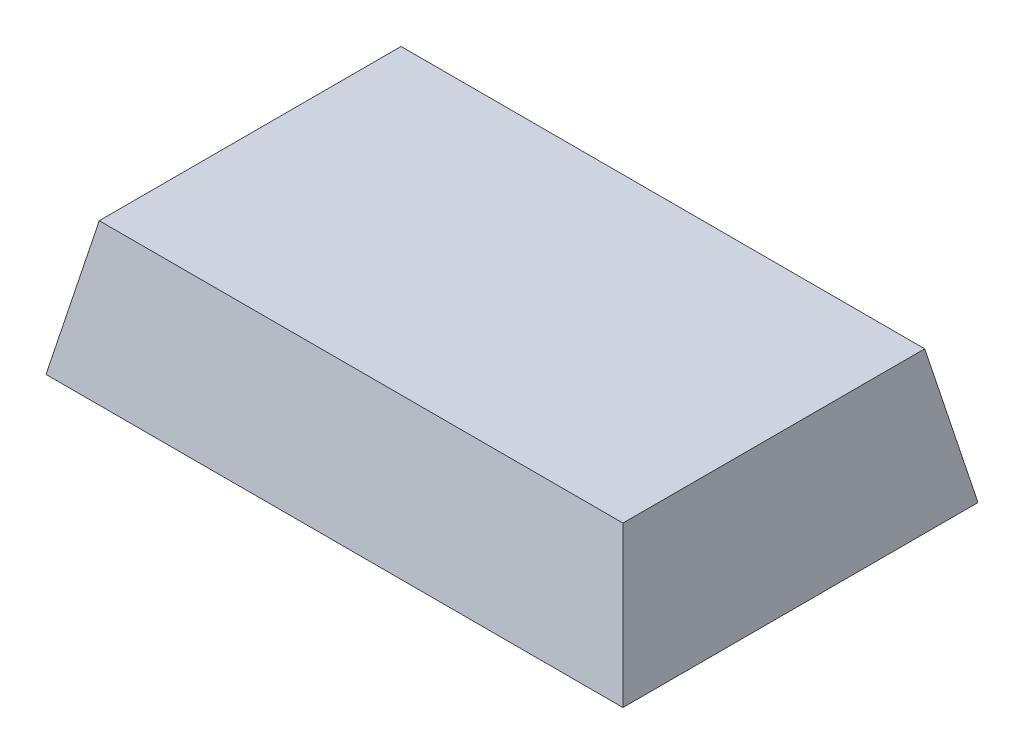
from build123d import *

# Parameters (mm, degrees)
SKETCH1_W               = 13
SKETCH1_H               = 8
BOSS_EXTRUDE1_DEPTH     = 3
CUT_EXTRUDE1_DEPTH      = 16.556349186
CUT_EXTRUDE1_DEPTH_BACK = 16.556349186
CUT_EXTRUDE2_DEPTH      = 16.556349186
CUT_EXTRUDE2_DEPTH_BACK = 16.556349186
SKETCH4_R               = 1.8
CUT_EXTRUDE3_DEPTH      = 0.8
SKETCH5_W               = 8
SKETCH5_H               = 1
BOSS_EXTRUDE2_DEPTH     = 2
FILLET1_R               = 4


with BuildPart() as part:
    # Sketch1 → Boss-Extrude1 (new body)
    with BuildSketch(Plane(origin=(0, 0, 0), x_dir=(1, 0, 0), z_dir=(0, 1, 0))):
        with Locations((6.5, 4)):
            Rectangle(SKETCH1_W, SKETCH1_H)
    extrude(amount=BOSS_EXTRUDE1_DEPTH)

    # Sketch2 → Cut-Extrude1 (cut, two sides: drawn at the far end of the back side and taken through both)
    with BuildSketch(Plane.XY.offset(-CUT_EXTRUDE1_DEPTH_BACK)):
        Polygon((0, 0), (0.6, 3), (0, 3), align=None)
        Polygon((13, 0), (12.4, 3), (13, 3), align=None)
    extrude(amount=CUT_EXTRUDE1_DEPTH + CUT_EXTRUDE1_DEPTH_BACK, mode=Mode.SUBTRACT)

    # Sketch3 → Cut-Extrude2 (cut, two sides: drawn at the far end of the back side and taken through both)
    with BuildSketch(Plane(origin=(0, 0, 0), x_dir=(0, 0, -1), z_dir=(1, 0, 0)).offset(-CUT_EXTRUDE2_DEPTH_BACK)):
        Polygon((0, 0), (0.6, 3), (0, 3), align=None)
        Polygon((8, 3), (7.4, 3), (8, 0), align=None)
    extrude(amount=CUT_EXTRUDE2_DEPTH + CUT_EXTRUDE2_DEPTH_BACK, mode=Mode.SUBTRACT)

    # Sketch4 → Cut-Extrude3 (cut)
    with BuildSketch(Plane.XZ):
        with Locations(Location((6.50000125, -3.75, 0), (0, 0, 270))):
            Circle(SKETCH4_R)
    extrude(amount=-CUT_EXTRUDE3_DEPTH, mode=Mode.SUBTRACT)

    # Sketch5 → Boss-Extrude2 (add)
    with BuildSketch(Plane.XZ):
        with Locations((6.500011, -7.5)):
            Rectangle(SKETCH5_W, SKETCH5_H)
    extrude(amount=BOSS_EXTRUDE2_DEPTH)

    # Fillet1
    # the kernel refuses this fillet: 4 mm, written as the material it takes off along each edge
    with BuildSketch(Plane(origin=(10.500011, -2, -16.660254038), x_dir=(0, 1, 0), z_dir=(0, 0, 1)), Plane(origin=(2.500011, -2, 1.660254038), x_dir=(0, 1, 0), z_dir=(0, 0, -1))) as fillet1_piece_1:
        with BuildLine():
            CenterArc((4, 3.464101615), FILLET1_R, 180, 60)
            Line((0, 3.464101615), (-0.08, 3.464101615))
            Line((-0.08, 3.464101615), (-0.08, 0))
            Line((-0.08, 0), (0, -0.08))
            ThreePointArc((0, -0.08), (1, -0.08), (1.96, -0.069282032))
            Line((1.96, -0.069282032), (2, 0))
        make_face()
    extrude(amount=18.320508076, mode=Mode.SUBTRACT)


solid = part.part
